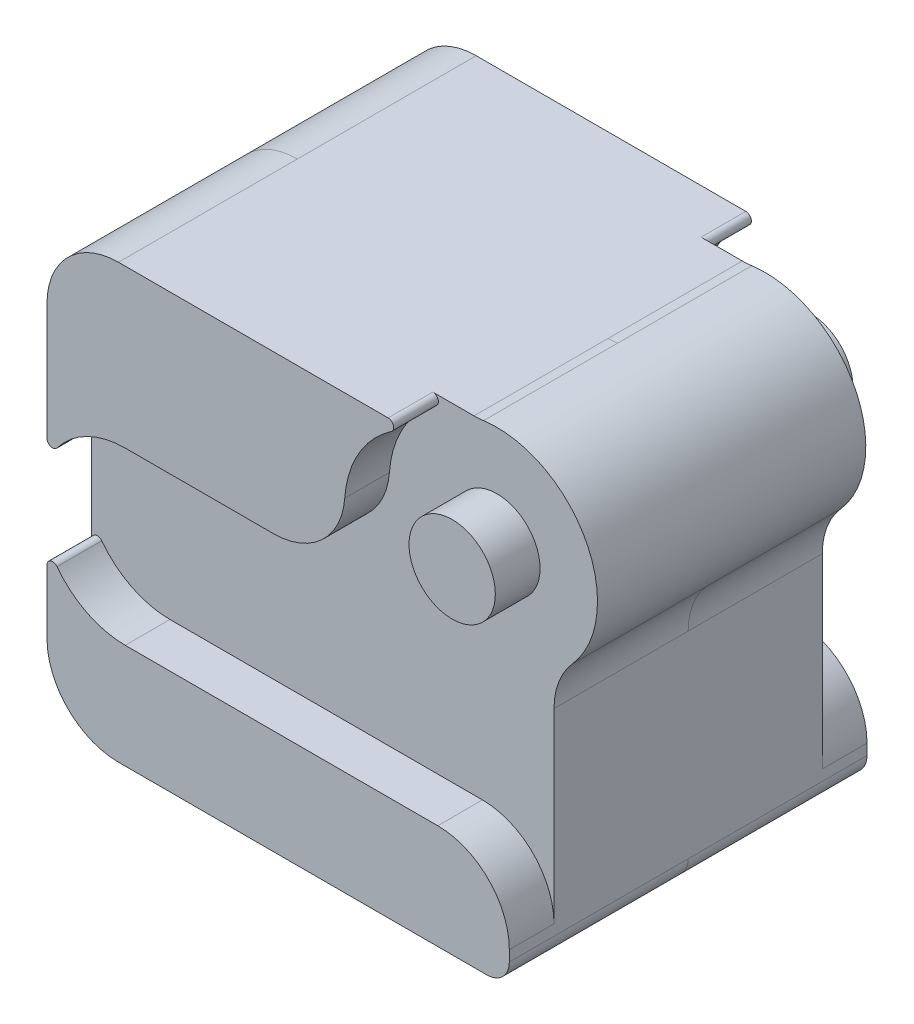
from build123d import *

# Parameters (mm, degrees)
BOSS_EXTRUDE1_DEPTH  = 6.35
CUT_EXTRUDE2_START   = -1.5875
SKETCH3_R            = 1.5319375
CUT_EXTRUDE2_DEPTH   = 1.5875
FILLET1_R            = 2.54
FILLET2_R            = 0.1984375
FILLET3_R            = 0.79375
FILLET1_OF_MIRROR1_R = 2.54
FILLET2_OF_MIRROR1_R = 0.1984375
FILLET3_OF_MIRROR1_R = 0.79375


with BuildPart() as part:
    # Sketch2 → Boss-Extrude1 (new body)
    with BuildSketch(Plane.XY):
        with BuildLine():
            Line((-5.81025, -3.96875), (-5.81025, 4.946707407))
            ThreePointArc((-5.81025, 4.946707407), (-4.533899852, 9.242205493), (-8.458861088, 11.404392535))
            Line((-8.458861088, 11.404392535), (-22.225, 11.404392535))
            Line((-22.225, 11.404392535), (-22.225, -3.96875))
            Line((-22.225, -3.96875), (-5.81025, -3.96875))
        make_face()
    boss_extrude1 = extrude(amount=BOSS_EXTRUDE1_DEPTH)

    # Sketch3 → Cut-Extrude2 (cut)
    with BuildSketch(Plane.XY.offset(6.35).offset(CUT_EXTRUDE2_START)):
        with BuildLine():
            Line((-11.051917114, 5.81025), (-19.446875, 5.81025))
            ThreePointArc((-19.446875, 5.81025), (-21.106735856, 5.315573316), (-22.225, 3.992951531))
            Line((-22.225, 3.992951531), (-22.225, 1.563298469))
            ThreePointArc((-22.225, 1.563298469), (-21.106735856, 0.240676684), (-19.446875, -0.254))
            Line((-19.446875, -0.254), (-5.81025, -0.254))
            Line((-5.81025, -0.254), (-5.81025, 4.946707407))
            ThreePointArc((-5.81025, 4.946707407), (-4.533899852, 9.242205493), (-8.458861088, 11.404392535))
            Line((-8.458861088, 11.404392535), (-9.343183884, 11.404392535))
            ThreePointArc((-9.343183884, 11.404392535), (-11.497600552, 9.004422113), (-11.051917114, 5.81025))
        make_face()
        with Locations((-7.838611503, 7.886782342)):
            Circle(SKETCH3_R, mode=Mode.SUBTRACT)
    cut_extrude2 = extrude(amount=CUT_EXTRUDE2_DEPTH, mode=Mode.SUBTRACT)

    # Fillet1
    fillet1_edges = [part.edges().sort_by_distance(p)[0] for p in [
        (-22.225, 11.404392535, 3.175),
        (-5.81025, 4.946707407, 2.38125),
        (-8.458861088, 11.404392535, 2.38125),
        (-11.051917114, 5.81025, 5.55625),
        (-5.81025, -0.254, 5.55625),
        (-22.225, -3.96875, 3.175),
    ]]
    fillet(fillet1_edges, radius=FILLET1_R)

    # Fillet2
    fillet2_edges = [part.edges().sort_by_distance(p)[0] for p in [
        (-22.225, 1.563298469, 5.55625),
        (-22.225, 3.992951531, 5.55625),
        (-9.343183884, 11.404392535, 5.55625),
    ]]
    fillet(fillet2_edges, radius=FILLET2_R)

    # Fillet3
    fillet3_edges = [part.edges().sort_by_distance(p)[0] for p in [
        (-5.81025, -3.96875, 3.175),
    ]]
    fillet(fillet3_edges, radius=FILLET3_R)

    # Mirror1: Boss-Extrude1, Cut-Extrude2 across plane
    add(boss_extrude1.mirror(Plane.XY))
    add(cut_extrude2.mirror(Plane.XY), mode=Mode.SUBTRACT)

    # Fillet1 of Mirror1
    fillet1_of_mirror1_edges = [part.edges().sort_by_distance(p)[0] for p in [
        (-22.225, 11.404392535, -3.175),
        (-5.81025, 4.946707407, -2.38125),
        (-8.458861088, 11.404392535, -2.38125),
        (-11.051917114, 5.81025, -5.55625),
        (-5.81025, -0.254, -5.55625),
        (-22.225, -3.96875, -3.175),
    ]]
    fillet(fillet1_of_mirror1_edges, radius=FILLET1_OF_MIRROR1_R)

    # Fillet2 of Mirror1
    fillet2_of_mirror1_edges = [part.edges().sort_by_distance(p)[0] for p in [
        (-22.225, 1.563298469, -5.55625),
        (-22.225, 3.992951531, -5.55625),
        (-9.343183884, 11.404392535, -5.55625),
    ]]
    fillet(fillet2_of_mirror1_edges, radius=FILLET2_OF_MIRROR1_R)

    # Fillet3 of Mirror1
    fillet3_of_mirror1_edges = [part.edges().sort_by_distance(p)[0] for p in [
        (-5.81025, -3.96875, -3.175),
    ]]
    fillet(fillet3_of_mirror1_edges, radius=FILLET3_OF_MIRROR1_R)


solid = part.part
